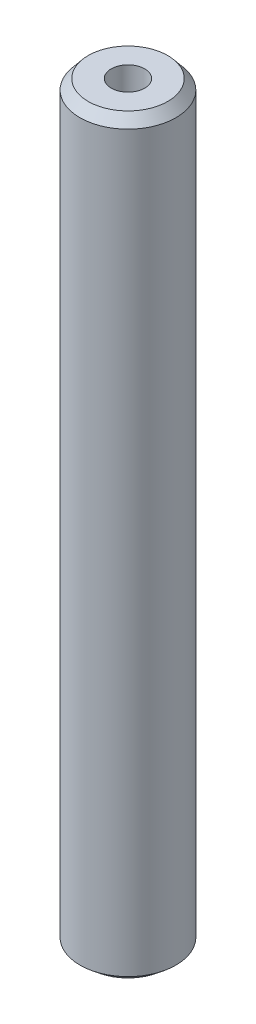
from build123d import *
from OCP.BRepFilletAPI import BRepFilletAPI_MakeChamfer

# Parameters (mm, degrees)
SKETCH1_R           = 27.5
BOSS_EXTRUDE1_DEPTH = 430.685620612
SKETCH2_R           = 9.59842998
CUT_EXTRUDE1_DEPTH  = 433.437976827
CHAMFER1_SIZE       = 5.702971004
CHAMFER1_SIZE2      = 4.714567732


with BuildPart() as part:
    # Sketch1 → Boss-Extrude1 (new body)
    with BuildSketch(Plane(origin=(0, 0, 0), x_dir=(1, 0, 0), z_dir=(0, 1, 0))):
        Circle(SKETCH1_R)
    extrude(amount=BOSS_EXTRUDE1_DEPTH)

    # Sketch2 → Cut-Extrude1 (cut, through all)
    with BuildSketch(Plane(origin=(0, 0, 0), x_dir=(1, 0, 0), z_dir=(0, 1, 0))):
        Circle(SKETCH2_R)
    extrude(amount=CUT_EXTRUDE1_DEPTH, mode=Mode.SUBTRACT)

    # Chamfer1: one chamfer whose edges measure the first distance from different faces: ONE call of the kernel's chamfer builder (chamfer() names one face for all edges)
    chamfer1_edges_1 = [part.edges().sort_by_distance(p)[0] for p in [
        (-27.5, 430.685620612, 0),
    ]]
    chamfer1_side_1 = [part.faces().sort_by_distance(p)[0] for p in [
        (-27.5, 215.342810306, 0),
    ]]
    chamfer1_edges_2 = [part.edges().sort_by_distance(p)[0] for p in [
        (-27.5, 0, 0),
    ]]
    chamfer1_side_2 = [part.faces().sort_by_distance(p)[0] for p in [
        (-26.722182541, 0, 0),
    ]]
    chamfer1 = BRepFilletAPI_MakeChamfer(part.part.solid().wrapped)
    for e in chamfer1_edges_1:
        chamfer1.Add(CHAMFER1_SIZE, CHAMFER1_SIZE2, e.wrapped, chamfer1_side_1[0].wrapped)  # the first distance lies on this face
    for e in chamfer1_edges_2:
        chamfer1.Add(CHAMFER1_SIZE, CHAMFER1_SIZE2, e.wrapped, chamfer1_side_2[0].wrapped)  # the first distance lies on this face
    add(Compound.cast(chamfer1.Shape()), mode=Mode.REPLACE)


solid = part.part
